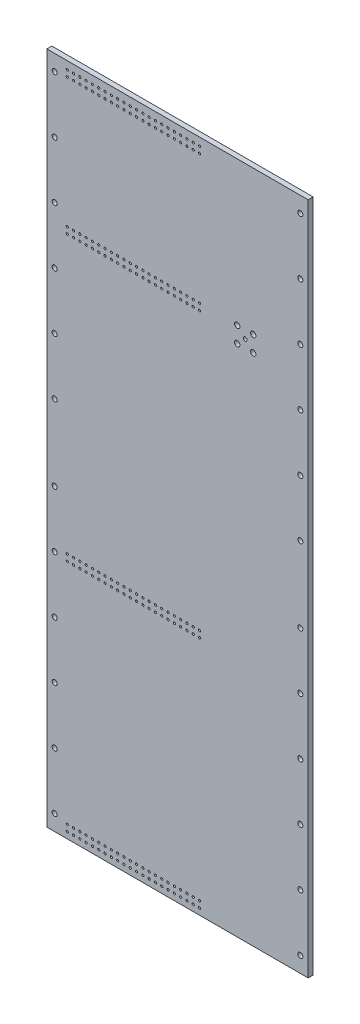
from build123d import *

# Parameters (mm, degrees)
SKETCH1_W                       = 83
SKETCH1_H                       = 214
BOSS_EXTRUDE1_DEPTH             = 1.5875
F_0_CLEARANCE_HOLE1_AT_2_COUNT  = 2
F_0_CLEARANCE_HOLE1_AT_2_PITCH  = 78
F_0_CLEARANCE_HOLE1_AT_3_COUNT  = 2
F_0_CLEARANCE_HOLE1_AT_3_PITCH  = 80.049984385
F_0_CLEARANCE_HOLE1_AT_4_COUNT  = 2
F_0_CLEARANCE_HOLE1_AT_4_PITCH  = 85.90692638
F_0_CLEARANCE_HOLE1_AT_5_COUNT  = 2
F_0_CLEARANCE_HOLE1_AT_5_PITCH  = 94.868329805
F_0_CLEARANCE_HOLE1_AT_6_COUNT  = 2
F_0_CLEARANCE_HOLE1_AT_6_PITCH  = 106.150836078
F_0_CLEARANCE_HOLE1_AT_7_COUNT  = 2
F_0_CLEARANCE_HOLE1_AT_7_PITCH  = 119.096599448
F_0_CLEARANCE_HOLE1_AT_8_COUNT  = 2
F_0_CLEARANCE_HOLE1_AT_8_PITCH  = 18
F_0_CLEARANCE_HOLE1_AT_9_COUNT  = 2
F_0_CLEARANCE_HOLE1_AT_9_PITCH  = 36
F_0_CLEARANCE_HOLE1_AT_10_COUNT = 2
F_0_CLEARANCE_HOLE1_AT_10_PITCH = 54
F_0_CLEARANCE_HOLE1_AT_11_COUNT = 2
F_0_CLEARANCE_HOLE1_AT_11_PITCH = 72
F_0_CLEARANCE_HOLE1_AT_12_COUNT = 2
F_0_CLEARANCE_HOLE1_AT_12_PITCH = 90
SKETCH6_W                       = 72.5
SKETCH6_H                       = 7
BOSS_EXTRUDE3_DEPTH             = 4.9125
SKETCH7_R                       = 0.35
SKETCH7_R_2                     = 0.6
SKETCH7_R_3                     = 0.85
CUT_EXTRUDE1_DEPTH              = 115.949989126


with BuildPart() as part:
    # Sketch1 → Boss-Extrude1 (new body)
    with BuildSketch(Plane.XY):
        Rectangle(SKETCH1_W, SKETCH1_H)
    extrude(amount=BOSS_EXTRUDE1_DEPTH)

    # Sketch3 → #0 Clearance Hole1 (revolve, cut)
    with BuildSketch(Plane(origin=(-39, 102, 1.5875), x_dir=(0, -1, 0), z_dir=(1, 0, 0))):
        Polygon((0, 0), (0, 3.659564046), (0.80645, 3.175), (0.80645, 0), align=None)
    f_0_clearance_hole1 = revolve(axis=Axis((-39, 102, 7.9375), (0, 0, -1)), mode=Mode.SUBTRACT)

    # #0 Clearance Hole1 at 2: #0 Clearance Hole1 ×2
    with Locations(*[(i * F_0_CLEARANCE_HOLE1_AT_2_PITCH, 0, 0) for i in range(1, F_0_CLEARANCE_HOLE1_AT_2_COUNT)]):
        add(f_0_clearance_hole1, mode=Mode.SUBTRACT)

    # #0 Clearance Hole1 at 3: #0 Clearance Hole1 ×2
    with Locations(*[Vector(0.97439119569462, -0.22485950669875804, 0) * (i * F_0_CLEARANCE_HOLE1_AT_3_PITCH) for i in range(1, F_0_CLEARANCE_HOLE1_AT_3_COUNT)]):
        add(f_0_clearance_hole1, mode=Mode.SUBTRACT)

    # #0 Clearance Hole1 at 4: #0 Clearance Hole1 ×2
    with Locations(*[Vector(0.9079593845004524, -0.4190581774617453, 0) * (i * F_0_CLEARANCE_HOLE1_AT_4_PITCH) for i in range(1, F_0_CLEARANCE_HOLE1_AT_4_COUNT)]):
        add(f_0_clearance_hole1, mode=Mode.SUBTRACT)

    # #0 Clearance Hole1 at 5: #0 Clearance Hole1 ×2
    with Locations(*[Vector(0.8221921916437805, -0.5692099788303054, 0) * (i * F_0_CLEARANCE_HOLE1_AT_5_PITCH) for i in range(1, F_0_CLEARANCE_HOLE1_AT_5_COUNT)]):
        add(f_0_clearance_hole1, mode=Mode.SUBTRACT)

    # #0 Clearance Hole1 at 6: #0 Clearance Hole1 ×2
    with Locations(*[Vector(0.7348034446274911, -0.6782801027330623, 0) * (i * F_0_CLEARANCE_HOLE1_AT_6_PITCH) for i in range(1, F_0_CLEARANCE_HOLE1_AT_6_COUNT)]):
        add(f_0_clearance_hole1, mode=Mode.SUBTRACT)

    # #0 Clearance Hole1 at 7: #0 Clearance Hole1 ×2
    with Locations(*[Vector(0.6549305384178465, -0.7556890827898136, 0) * (i * F_0_CLEARANCE_HOLE1_AT_7_PITCH) for i in range(1, F_0_CLEARANCE_HOLE1_AT_7_COUNT)]):
        add(f_0_clearance_hole1, mode=Mode.SUBTRACT)

    # #0 Clearance Hole1 at 8: #0 Clearance Hole1 ×2
    with Locations(*[(0, -i * F_0_CLEARANCE_HOLE1_AT_8_PITCH, 0) for i in range(1, F_0_CLEARANCE_HOLE1_AT_8_COUNT)]):
        add(f_0_clearance_hole1, mode=Mode.SUBTRACT)

    # #0 Clearance Hole1 at 9: #0 Clearance Hole1 ×2
    with Locations(*[(0, -i * F_0_CLEARANCE_HOLE1_AT_9_PITCH, 0) for i in range(1, F_0_CLEARANCE_HOLE1_AT_9_COUNT)]):
        add(f_0_clearance_hole1, mode=Mode.SUBTRACT)

    # #0 Clearance Hole1 at 10: #0 Clearance Hole1 ×2
    with Locations(*[(0, -i * F_0_CLEARANCE_HOLE1_AT_10_PITCH, 0) for i in range(1, F_0_CLEARANCE_HOLE1_AT_10_COUNT)]):
        add(f_0_clearance_hole1, mode=Mode.SUBTRACT)

    # #0 Clearance Hole1 at 11: #0 Clearance Hole1 ×2
    with Locations(*[(0, -i * F_0_CLEARANCE_HOLE1_AT_11_PITCH, 0) for i in range(1, F_0_CLEARANCE_HOLE1_AT_11_COUNT)]):
        add(f_0_clearance_hole1, mode=Mode.SUBTRACT)

    # #0 Clearance Hole1 at 12: #0 Clearance Hole1 ×2
    with Locations(*[(0, -i * F_0_CLEARANCE_HOLE1_AT_12_PITCH, 0) for i in range(1, F_0_CLEARANCE_HOLE1_AT_12_COUNT)]):
        add(f_0_clearance_hole1, mode=Mode.SUBTRACT)

    # Sketch6 → Boss-Extrude3 (add)
    with BuildSketch(Plane(origin=(0, 0, 0), x_dir=(-1, 0, 0), z_dir=(0, 0, -1))):
        with Locations((0.05, -3.5)):
            Rectangle(SKETCH6_W, SKETCH6_H)
    extrude(amount=BOSS_EXTRUDE3_DEPTH)

    # Sketch7 → Cut-Extrude1 (cut, through all)
    with BuildSketch(Plane.XY.offset(1.5875)):
        with Locations((-35, 102.5)):
            Circle(SKETCH7_R)
        with Locations((-33, 102.5)):
            Circle(SKETCH7_R)
        with Locations((-31, 102.5)):
            Circle(SKETCH7_R)
        with Locations((-29, 102.5)):
            Circle(SKETCH7_R)
        with Locations((-27, 102.5)):
            Circle(SKETCH7_R)
        with Locations((-25, 102.5)):
            Circle(SKETCH7_R)
        with Locations((-23, 102.5)):
            Circle(SKETCH7_R)
        with Locations((-21, 102.5)):
            Circle(SKETCH7_R)
        with Locations((-19, 102.5)):
            Circle(SKETCH7_R)
        with Locations((-17, 102.5)):
            Circle(SKETCH7_R)
        with Locations((-15, 102.5)):
            Circle(SKETCH7_R)
        with Locations((-13, 102.5)):
            Circle(SKETCH7_R)
        with Locations((-11, 102.5)):
            Circle(SKETCH7_R)
        with Locations((-9, 102.5)):
            Circle(SKETCH7_R)
        with Locations((-7, 102.5)):
            Circle(SKETCH7_R)
        with Locations((-5, 102.5)):
            Circle(SKETCH7_R)
        with Locations((-3, 102.5)):
            Circle(SKETCH7_R)
        with Locations((-1, 102.5)):
            Circle(SKETCH7_R)
        with Locations((1, 102.5)):
            Circle(SKETCH7_R)
        with Locations((3, 102.5)):
            Circle(SKETCH7_R)
        with Locations((5, 102.5)):
            Circle(SKETCH7_R)
        with Locations((7, 102.5)):
            Circle(SKETCH7_R)
        with Locations((-33, 104.5)):
            Circle(SKETCH7_R)
        with Locations((-31, 104.5)):
            Circle(SKETCH7_R)
        with Locations((-29, 104.5)):
            Circle(SKETCH7_R)
        with Locations((-27, 104.5)):
            Circle(SKETCH7_R)
        with Locations((-25, 104.5)):
            Circle(SKETCH7_R)
        with Locations((-23, 104.5)):
            Circle(SKETCH7_R)
        with Locations((-21, 104.5)):
            Circle(SKETCH7_R)
        with Locations((-19, 104.5)):
            Circle(SKETCH7_R)
        with Locations((-17, 104.5)):
            Circle(SKETCH7_R)
        with Locations((-15, 104.5)):
            Circle(SKETCH7_R)
        with Locations((-13, 104.5)):
            Circle(SKETCH7_R)
        with Locations((-11, 104.5)):
            Circle(SKETCH7_R)
        with Locations((-9, 104.5)):
            Circle(SKETCH7_R)
        with Locations((-7, 104.5)):
            Circle(SKETCH7_R)
        with Locations((-5, 104.5)):
            Circle(SKETCH7_R)
        with Locations((-3, 104.5)):
            Circle(SKETCH7_R)
        with Locations((-1, 104.5)):
            Circle(SKETCH7_R)
        with Locations((1, 104.5)):
            Circle(SKETCH7_R)
        with Locations((3, 104.5)):
            Circle(SKETCH7_R)
        with Locations((5, 104.5)):
            Circle(SKETCH7_R)
        with Locations((7, 104.5)):
            Circle(SKETCH7_R)
        with Locations((-35, 104.5)):
            Circle(SKETCH7_R)
        with Locations((-35, 59.325)):
            Circle(SKETCH7_R)
        with Locations((-33, 59.325)):
            Circle(SKETCH7_R)
        with Locations((-31, 59.325)):
            Circle(SKETCH7_R)
        with Locations((-29, 59.325)):
            Circle(SKETCH7_R)
        with Locations((-27, 59.325)):
            Circle(SKETCH7_R)
        with Locations((-25, 59.325)):
            Circle(SKETCH7_R)
        with Locations((-23, 59.325)):
            Circle(SKETCH7_R)
        with Locations((-21, 59.325)):
            Circle(SKETCH7_R)
        with Locations((-19, 59.325)):
            Circle(SKETCH7_R)
        with Locations((-17, 59.325)):
            Circle(SKETCH7_R)
        with Locations((-15, 59.325)):
            Circle(SKETCH7_R)
        with Locations((-13, 59.325)):
            Circle(SKETCH7_R)
        with Locations((-11, 59.325)):
            Circle(SKETCH7_R)
        with Locations((-9, 59.325)):
            Circle(SKETCH7_R)
        with Locations((-7, 59.325)):
            Circle(SKETCH7_R)
        with Locations((-5, 59.325)):
            Circle(SKETCH7_R)
        with Locations((-3, 59.325)):
            Circle(SKETCH7_R)
        with Locations((-1, 59.325)):
            Circle(SKETCH7_R)
        with Locations((1, 59.325)):
            Circle(SKETCH7_R)
        with Locations((3, 59.325)):
            Circle(SKETCH7_R)
        with Locations((5, 59.325)):
            Circle(SKETCH7_R)
        with Locations((7, 59.325)):
            Circle(SKETCH7_R)
        with Locations((-33, 61.325)):
            Circle(SKETCH7_R)
        with Locations((-31, 61.325)):
            Circle(SKETCH7_R)
        with Locations((-29, 61.325)):
            Circle(SKETCH7_R)
        with Locations((-27, 61.325)):
            Circle(SKETCH7_R)
        with Locations((-25, 61.325)):
            Circle(SKETCH7_R)
        with Locations((-23, 61.325)):
            Circle(SKETCH7_R)
        with Locations((-21, 61.325)):
            Circle(SKETCH7_R)
        with Locations((-19, 61.325)):
            Circle(SKETCH7_R)
        with Locations((-17, 61.325)):
            Circle(SKETCH7_R)
        with Locations((-15, 61.325)):
            Circle(SKETCH7_R)
        with Locations((-13, 61.325)):
            Circle(SKETCH7_R)
        with Locations((-11, 61.325)):
            Circle(SKETCH7_R)
        with Locations((-9, 61.325)):
            Circle(SKETCH7_R)
        with Locations((-7, 61.325)):
            Circle(SKETCH7_R)
        with Locations((-5, 61.325)):
            Circle(SKETCH7_R)
        with Locations((-3, 61.325)):
            Circle(SKETCH7_R)
        with Locations((-1, 61.325)):
            Circle(SKETCH7_R)
        with Locations((1, 61.325)):
            Circle(SKETCH7_R)
        with Locations((3, 61.325)):
            Circle(SKETCH7_R)
        with Locations((5, 61.325)):
            Circle(SKETCH7_R)
        with Locations((7, 61.325)):
            Circle(SKETCH7_R)
        with Locations((-35, 61.325)):
            Circle(SKETCH7_R)
        with Locations((21.5, 58.706)):
            Circle(SKETCH7_R_2)
        with Locations((18.96, 61.246)):
            Circle(SKETCH7_R_3)
        with Locations((24.04, 61.246)):
            Circle(SKETCH7_R_3)
        with Locations((24.04, 56.166)):
            Circle(SKETCH7_R_3)
        with Locations((18.96, 56.166)):
            Circle(SKETCH7_R_3)
        with Locations((-35, -30.675)):
            Circle(SKETCH7_R)
        with Locations((-33, -30.675)):
            Circle(SKETCH7_R)
        with Locations((-31, -30.675)):
            Circle(SKETCH7_R)
        with Locations((-29, -30.675)):
            Circle(SKETCH7_R)
        with Locations((-27, -30.675)):
            Circle(SKETCH7_R)
        with Locations((-25, -30.675)):
            Circle(SKETCH7_R)
        with Locations((-23, -30.675)):
            Circle(SKETCH7_R)
        with Locations((-21, -30.675)):
            Circle(SKETCH7_R)
        with Locations((-19, -30.675)):
            Circle(SKETCH7_R)
        with Locations((-17, -30.675)):
            Circle(SKETCH7_R)
        with Locations((-15, -30.675)):
            Circle(SKETCH7_R)
        with Locations((-13, -30.675)):
            Circle(SKETCH7_R)
        with Locations((-11, -30.675)):
            Circle(SKETCH7_R)
        with Locations((-9, -30.675)):
            Circle(SKETCH7_R)
        with Locations((-7, -30.675)):
            Circle(SKETCH7_R)
        with Locations((-5, -30.675)):
            Circle(SKETCH7_R)
        with Locations((-3, -30.675)):
            Circle(SKETCH7_R)
        with Locations((-1, -30.675)):
            Circle(SKETCH7_R)
        with Locations((1, -30.675)):
            Circle(SKETCH7_R)
        with Locations((3, -30.675)):
            Circle(SKETCH7_R)
        with Locations((5, -30.675)):
            Circle(SKETCH7_R)
        with Locations((7, -30.675)):
            Circle(SKETCH7_R)
        with Locations((-33, -28.675)):
            Circle(SKETCH7_R)
        with Locations((-31, -28.675)):
            Circle(SKETCH7_R)
        with Locations((-29, -28.675)):
            Circle(SKETCH7_R)
        with Locations((-27, -28.675)):
            Circle(SKETCH7_R)
        with Locations((-25, -28.675)):
            Circle(SKETCH7_R)
        with Locations((-23, -28.675)):
            Circle(SKETCH7_R)
        with Locations((-21, -28.675)):
            Circle(SKETCH7_R)
        with Locations((-19, -28.675)):
            Circle(SKETCH7_R)
        with Locations((-17, -28.675)):
            Circle(SKETCH7_R)
        with Locations((-15, -28.675)):
            Circle(SKETCH7_R)
        with Locations((-13, -28.675)):
            Circle(SKETCH7_R)
        with Locations((-11, -28.675)):
            Circle(SKETCH7_R)
        with Locations((-9, -28.675)):
            Circle(SKETCH7_R)
        with Locations((-7, -28.675)):
            Circle(SKETCH7_R)
        with Locations((-5, -28.675)):
            Circle(SKETCH7_R)
        with Locations((-3, -28.675)):
            Circle(SKETCH7_R)
        with Locations((-1, -28.675)):
            Circle(SKETCH7_R)
        with Locations((1, -28.675)):
            Circle(SKETCH7_R)
        with Locations((3, -28.675)):
            Circle(SKETCH7_R)
        with Locations((5, -28.675)):
            Circle(SKETCH7_R)
        with Locations((7, -28.675)):
            Circle(SKETCH7_R)
        with Locations((-35, -28.675)):
            Circle(SKETCH7_R)
        with Locations((-35, -105)):
            Circle(SKETCH7_R)
        with Locations((-33, -105)):
            Circle(SKETCH7_R)
        with Locations((-31, -105)):
            Circle(SKETCH7_R)
        with Locations((-29, -105)):
            Circle(SKETCH7_R)
        with Locations((-27, -105)):
            Circle(SKETCH7_R)
        with Locations((-25, -105)):
            Circle(SKETCH7_R)
        with Locations((-23, -105)):
            Circle(SKETCH7_R)
        with Locations((-21, -105)):
            Circle(SKETCH7_R)
        with Locations((-19, -105)):
            Circle(SKETCH7_R)
        with Locations((-17, -105)):
            Circle(SKETCH7_R)
        with Locations((-15, -105)):
            Circle(SKETCH7_R)
        with Locations((-13, -105)):
            Circle(SKETCH7_R)
        with Locations((-11, -105)):
            Circle(SKETCH7_R)
        with Locations((-9, -105)):
            Circle(SKETCH7_R)
        with Locations((-7, -105)):
            Circle(SKETCH7_R)
        with Locations((-5, -105)):
            Circle(SKETCH7_R)
        with Locations((-3, -105)):
            Circle(SKETCH7_R)
        with Locations((-1, -105)):
            Circle(SKETCH7_R)
        with Locations((1, -105)):
            Circle(SKETCH7_R)
        with Locations((3, -105)):
            Circle(SKETCH7_R)
        with Locations((5, -105)):
            Circle(SKETCH7_R)
        with Locations((7, -105)):
            Circle(SKETCH7_R)
        with Locations((-33, -103)):
            Circle(SKETCH7_R)
        with Locations((-31, -103)):
            Circle(SKETCH7_R)
        with Locations((-29, -103)):
            Circle(SKETCH7_R)
        with Locations((-27, -103)):
            Circle(SKETCH7_R)
        with Locations((-25, -103)):
            Circle(SKETCH7_R)
        with Locations((-23, -103)):
            Circle(SKETCH7_R)
        with Locations((-21, -103)):
            Circle(SKETCH7_R)
        with Locations((-19, -103)):
            Circle(SKETCH7_R)
        with Locations((-17, -103)):
            Circle(SKETCH7_R)
        with Locations((-15, -103)):
            Circle(SKETCH7_R)
        with Locations((-13, -103)):
            Circle(SKETCH7_R)
        with Locations((-11, -103)):
            Circle(SKETCH7_R)
        with Locations((-9, -103)):
            Circle(SKETCH7_R)
        with Locations((-7, -103)):
            Circle(SKETCH7_R)
        with Locations((-5, -103)):
            Circle(SKETCH7_R)
        with Locations((-3, -103)):
            Circle(SKETCH7_R)
        with Locations((-1, -103)):
            Circle(SKETCH7_R)
        with Locations((1, -103)):
            Circle(SKETCH7_R)
        with Locations((3, -103)):
            Circle(SKETCH7_R)
        with Locations((5, -103)):
            Circle(SKETCH7_R)
        with Locations((7, -103)):
            Circle(SKETCH7_R)
        with Locations((-35, -103)):
            Circle(SKETCH7_R)
    extrude(amount=-CUT_EXTRUDE1_DEPTH, mode=Mode.SUBTRACT)

    # Mirror1: #0 Clearance Hole1 across plane
    add(f_0_clearance_hole1.mirror(Plane.ZX), mode=Mode.SUBTRACT)

    # Mirror1 copy 1 sketch → Mirror1 copy 1 (revolve, cut)
    with BuildSketch(Plane(origin=(39, -102, 1.5875), x_dir=(0, 1, 0), z_dir=(1, 0, 0))):
        Polygon((0, 0), (0, -3.659564046), (0.80645, -3.175), (0.80645, 0), align=None)
    revolve(axis=Axis((39, -102, 7.9375), (0, 0, 1)), mode=Mode.SUBTRACT)

    # Mirror1 copy 2 sketch → Mirror1 copy 2 (revolve, cut)
    with BuildSketch(Plane(origin=(39, -84, 1.5875), x_dir=(0, 1, 0), z_dir=(1, 0, 0))):
        Polygon((0, 0), (0, -3.659564046), (0.80645, -3.175), (0.80645, 0), align=None)
    revolve(axis=Axis((39, -84, 7.9375), (0, 0, 1)), mode=Mode.SUBTRACT)

    # Mirror1 copy 3 sketch → Mirror1 copy 3 (revolve, cut)
    with BuildSketch(Plane(origin=(39, -66, 1.5875), x_dir=(0, 1, 0), z_dir=(1, 0, 0))):
        Polygon((0, 0), (0, -3.659564046), (0.80645, -3.175), (0.80645, 0), align=None)
    revolve(axis=Axis((39, -66, 7.9375), (0, 0, 1)), mode=Mode.SUBTRACT)

    # Mirror1 copy 4 sketch → Mirror1 copy 4 (revolve, cut)
    with BuildSketch(Plane(origin=(39, -48, 1.5875), x_dir=(0, 1, 0), z_dir=(1, 0, 0))):
        Polygon((0, 0), (0, -3.659564046), (0.80645, -3.175), (0.80645, 0), align=None)
    revolve(axis=Axis((39, -48, 7.9375), (0, 0, 1)), mode=Mode.SUBTRACT)

    # Mirror1 copy 5 sketch → Mirror1 copy 5 (revolve, cut)
    with BuildSketch(Plane(origin=(39, -30, 1.5875), x_dir=(0, 1, 0), z_dir=(1, 0, 0))):
        Polygon((0, 0), (0, -3.659564046), (0.80645, -3.175), (0.80645, 0), align=None)
    revolve(axis=Axis((39, -30, 7.9375), (0, 0, 1)), mode=Mode.SUBTRACT)

    # Mirror1 copy 6 sketch → Mirror1 copy 6 (revolve, cut)
    with BuildSketch(Plane(origin=(39, -12, 1.5875), x_dir=(0, 1, 0), z_dir=(1, 0, 0))):
        Polygon((0, 0), (0, -3.659564046), (0.80645, -3.175), (0.80645, 0), align=None)
    revolve(axis=Axis((39, -12, 7.9375), (0, 0, 1)), mode=Mode.SUBTRACT)

    # Mirror1 copy 7 sketch → Mirror1 copy 7 (revolve, cut)
    with BuildSketch(Plane(origin=(-39, -84, 1.5875), x_dir=(0, 1, 0), z_dir=(1, 0, 0))):
        Polygon((0, 0), (0, -3.659564046), (0.80645, -3.175), (0.80645, 0), align=None)
    revolve(axis=Axis((-39, -84, 7.9375), (0, 0, 1)), mode=Mode.SUBTRACT)

    # Mirror1 copy 8 sketch → Mirror1 copy 8 (revolve, cut)
    with BuildSketch(Plane(origin=(-39, -66, 1.5875), x_dir=(0, 1, 0), z_dir=(1, 0, 0))):
        Polygon((0, 0), (0, -3.659564046), (0.80645, -3.175), (0.80645, 0), align=None)
    revolve(axis=Axis((-39, -66, 7.9375), (0, 0, 1)), mode=Mode.SUBTRACT)

    # Mirror1 copy 9 sketch → Mirror1 copy 9 (revolve, cut)
    with BuildSketch(Plane(origin=(-39, -48, 1.5875), x_dir=(0, 1, 0), z_dir=(1, 0, 0))):
        Polygon((0, 0), (0, -3.659564046), (0.80645, -3.175), (0.80645, 0), align=None)
    revolve(axis=Axis((-39, -48, 7.9375), (0, 0, 1)), mode=Mode.SUBTRACT)

    # Mirror1 copy 10 sketch → Mirror1 copy 10 (revolve, cut)
    with BuildSketch(Plane(origin=(-39, -30, 1.5875), x_dir=(0, 1, 0), z_dir=(1, 0, 0))):
        Polygon((0, 0), (0, -3.659564046), (0.80645, -3.175), (0.80645, 0), align=None)
    revolve(axis=Axis((-39, -30, 7.9375), (0, 0, 1)), mode=Mode.SUBTRACT)

    # Mirror1 copy 11 sketch → Mirror1 copy 11 (revolve, cut)
    with BuildSketch(Plane(origin=(-39, -12, 1.5875), x_dir=(0, 1, 0), z_dir=(1, 0, 0))):
        Polygon((0, 0), (0, -3.659564046), (0.80645, -3.175), (0.80645, 0), align=None)
    revolve(axis=Axis((-39, -12, 7.9375), (0, 0, 1)), mode=Mode.SUBTRACT)


solid = part.part
